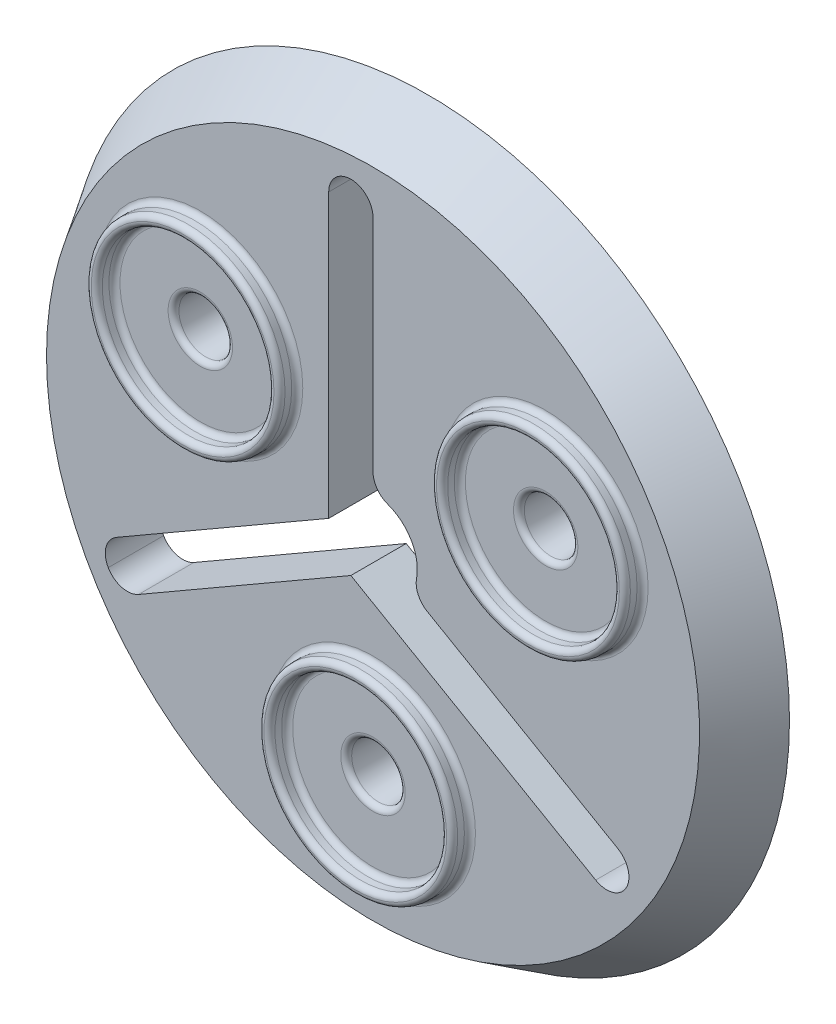
from build123d import *

# Parameters (mm, degrees)
SKETCH1_R                   = 32.6
BOSS_EXTRUDE1_DEPTH         = 5
CHAMFER1_SIZE               = 5
CHAMFER1_SIZE_2             = 3.12434676
CUT_EXTRUDE1_START          = 5
SKETCH2_R                   = 2.25
CUT_EXTRUDE1_DEPTH          = 52.373699443
CUT_EXTRUDE1_DRAFT          = 2
SKETCH3_R                   = 8.75
SKETCH3_R_2                 = 7.75
BOSS_EXTRUDE2_DEPTH         = 1.6
SKETCH5_R                   = 3.25
CUT_EXTRUDE3_DEPTH          = 0.8
FILLET1_R                   = 0.5
FILLET2_R                   = 0.5
CIRPATTERN3_COUNT           = 3
CIRPATTERN3_START           = 5
CIRPATTERN3_COPY_1_SKETCH_R = 2.25
CIRPATTERN3_COPY_1_DEPTH    = 52.373699443
CIRPATTERN3_COPY_1_DRAFT    = 2
CIRPATTERN3_COPY_2_SKETCH_R = 2.25
CIRPATTERN3_COPY_2_DEPTH    = 52.373699443
CIRPATTERN3_COPY_2_DRAFT    = 2
FILLET1_OF_CIRPATTERN3_R    = 0.5
FILLET2_OF_CIRPATTERN3_R    = 0.5
SKETCH4_R                   = 4
CUT_EXTRUDE2_DEPTH          = 47.573382971
FILLET3_R                   = 2


with BuildPart() as part:
    # Sketch1 → Boss-Extrude1 (new body)
    with BuildSketch(Plane(origin=(0, 0, 0), x_dir=(0, 1, 0), z_dir=(0, 0, 1))):
        with Locations(Location((0, 0, 0), (0, 0, 270))):
            Circle(SKETCH1_R)
    extrude(amount=BOSS_EXTRUDE1_DEPTH)

    # Chamfer1
    # the kernel refuses this chamfer: 5, 3.12434676 mm, written as the material it takes off along each edge
    with BuildSketch(Plane(origin=(0, 0, 5), x_dir=(1, 0, 0), z_dir=(0, -1, 0))) as chamfer1_piece_1:
        Polygon((32.6, -CHAMFER1_SIZE), (32.6 - CHAMFER1_SIZE_2, 0), (32.6, 0), align=None)
    revolve(axis=Axis((0, 0, 5), (0, 0, 1)), mode=Mode.SUBTRACT)


with BuildPart() as cut_extrude1_tool:
    # Sketch2 → Cut-Extrude1 (with draft: the straight prism first)
    with BuildSketch(Plane(origin=(0, 0, 5), x_dir=(1, 0, 0), z_dir=(0, 0, -1)).offset(CUT_EXTRUDE1_START)):
        with Locations((0, 18)):
            Circle(SKETCH2_R)
    extrude(amount=-CUT_EXTRUDE1_DEPTH)
    # Cut-Extrude1: the draft: its side faces are tilted about the plane it starts from
    cut_extrude1_sides = [cut_extrude1_tool.faces().sort_by_distance(p)[0] for p in [
        (-2.25, -18, 26.186849721),
    ]]
    draft(cut_extrude1_sides, Plane(origin=(0, 0, 5), x_dir=(1, 0, 0), z_dir=(0, 0, -1)).offset(CUT_EXTRUDE1_START), CUT_EXTRUDE1_DRAFT)


with BuildPart() as part_1:
    add(part.part)

    # Cut-Extrude1: cut by cut_extrude1_tool
    add(cut_extrude1_tool.part, mode=Mode.SUBTRACT)

    # Sketch3 → Boss-Extrude2 (add)
    with BuildSketch(Plane.XY.offset(5)):
        with Locations((0, -18)):
            Circle(SKETCH3_R)
        with Locations((0, -18)):
            Circle(SKETCH3_R_2, mode=Mode.SUBTRACT)
    boss_extrude2 = extrude(amount=BOSS_EXTRUDE2_DEPTH)

    # Sketch5 → Cut-Extrude3 (cut)
    with BuildSketch(Plane(origin=(0, 0, 0), x_dir=(1, 0, 0), z_dir=(0, 0, -1))):
        with Locations(Location((0, 18, 0), (0, 0, 180))):
            Circle(SKETCH5_R)
    cut_extrude3 = extrude(amount=-CUT_EXTRUDE3_DEPTH, mode=Mode.SUBTRACT)

    # Fillet1
    fillet1_edges = [part_1.edges().sort_by_distance(p)[0] for p in [
        (-8.75, -18, 6.6),
        (-7.75, -18, 6.6),
    ]]
    fillet(fillet1_edges, radius=FILLET1_R - 0.0001)  # a hair under: the kernel refuses the full size

    # Fillet2
    fillet2_edges = [part_1.edges().sort_by_distance(p)[0] for p in [
        (-2.424603847, -18, 5),
        (-7.75, -18, 5),
        (-8.75, -18, 5),
    ]]
    fillet(fillet2_edges, radius=FILLET2_R)

    # CirPattern3: Boss-Extrude2, Cut-Extrude3 ×3 about axis
    cirpattern3_axis = Axis((0, 0, 0), (0, 0, 1))
    add([boss_extrude2.rotate(cirpattern3_axis, i * 360 / CIRPATTERN3_COUNT) for i in range(1, CIRPATTERN3_COUNT)])
    add([cut_extrude3.rotate(cirpattern3_axis, i * 360 / CIRPATTERN3_COUNT) for i in range(1, CIRPATTERN3_COUNT)], mode=Mode.SUBTRACT)


with BuildPart() as cirpattern3_copy_1_tool:
    # CirPattern3 copy 1 sketch → CirPattern3 copy 1 (with draft: the straight prism first)
    with BuildSketch(Plane(origin=(0, 0, 5), x_dir=(-0.4999999999999998, 0.8660254037844387, 0), z_dir=(0, 0, -1)).offset(CIRPATTERN3_START)):
        with Locations((0, 18)):
            Circle(CIRPATTERN3_COPY_1_SKETCH_R)
    extrude(amount=-CIRPATTERN3_COPY_1_DEPTH)
    # CirPattern3 copy 1: the draft: its side faces are tilted about the plane it starts from
    cirpattern3_copy_1_sides = [cirpattern3_copy_1_tool.faces().sort_by_distance(p)[0] for p in [
        (16.713457268, 7.051442841, 26.186849721),
    ]]
    draft(cirpattern3_copy_1_sides, Plane(origin=(0, 0, 5), x_dir=(-0.4999999999999998, 0.8660254037844387, 0), z_dir=(0, 0, -1)).offset(CIRPATTERN3_START), CIRPATTERN3_COPY_1_DRAFT)


with BuildPart() as part_2:
    add(part_1.part)

    # CirPattern3 copy 1: cut by cirpattern3_copy_1_tool
    add(cirpattern3_copy_1_tool.part, mode=Mode.SUBTRACT)


with BuildPart() as cirpattern3_copy_2_tool:
    # CirPattern3 copy 2 sketch → CirPattern3 copy 2 (with draft: the straight prism first)
    with BuildSketch(Plane(origin=(0, 0, 5), x_dir=(-0.5000000000000004, -0.8660254037844384, 0), z_dir=(0, 0, -1)).offset(CIRPATTERN3_START)):
        with Locations((0, 18)):
            Circle(CIRPATTERN3_COPY_2_SKETCH_R)
    extrude(amount=-CIRPATTERN3_COPY_2_DEPTH)
    # CirPattern3 copy 2: the draft: its side faces are tilted about the plane it starts from
    cirpattern3_copy_2_sides = [cirpattern3_copy_2_tool.faces().sort_by_distance(p)[0] for p in [
        (-14.463457268, 10.948557159, 26.186849721),
    ]]
    draft(cirpattern3_copy_2_sides, Plane(origin=(0, 0, 5), x_dir=(-0.5000000000000004, -0.8660254037844384, 0), z_dir=(0, 0, -1)).offset(CIRPATTERN3_START), CIRPATTERN3_COPY_2_DRAFT)


with BuildPart() as part_3:
    add(part_2.part)

    # CirPattern3 copy 2: cut by cirpattern3_copy_2_tool
    add(cirpattern3_copy_2_tool.part, mode=Mode.SUBTRACT)

    # Fillet1 of CirPattern3
    fillet1_of_cirpattern3_edges = [part_3.edges().sort_by_distance(p)[0] for p in [
        (19.963457268, 1.422277717, 6.6),
        (19.463457268, 2.288303121, 6.6),
        (-11.213457268, 16.577722283, 6.6),
        (-11.713457268, 15.711696879, 6.6),
    ]]
    fillet(fillet1_of_cirpattern3_edges, radius=FILLET1_OF_CIRPATTERN3_R - 0.0001)  # a hair under: the kernel refuses the full size

    # Fillet2 of CirPattern3
    fillet2_of_cirpattern3_edges = [part_3.edges().sort_by_distance(p)[0] for p in [
        (16.800759192, 6.900231474, 5),
        (19.463457268, 2.288303121, 5),
        (19.963457268, 1.422277717, 5),
        (-14.376155344, 11.099768526, 5),
        (-11.713457268, 15.711696879, 5),
        (-11.213457268, 16.577722283, 5),
    ]]
    fillet(fillet2_of_cirpattern3_edges, radius=FILLET2_OF_CIRPATTERN3_R)

    # Sketch4 → Cut-Extrude2 (cut, through all)
    with BuildSketch(Plane(origin=(0, 0, 0), x_dir=(1, 0, 0), z_dir=(0, 0, -1))):
        with BuildLine():
            Line((21.649947146, 17.118404966), (-2, 3.464101615))
            ThreePointArc((-2, 3.464101615), (1.03527618, 3.863703305), (3.464101615, 2))
            Line((3.464101615, 2), (23.902301144, 13.8))
            ThreePointArc((23.902301144, 13.8), (22.836479237, 15.500168259), (21.649947146, 17.118404966))
        make_face()
        Circle(SKETCH4_R)
        with BuildLine():
            ThreePointArc((0, -4), (-2.828427125, -2.828427125), (-4, 0))
            Line((-4, 0), (-4, -27.308606702))
            ThreePointArc((-4, -27.308606702), (-2.005299856, -27.527055282), (0, -27.6))
            Line((0, -27.6), (0, -4))
        make_face()
        with BuildLine():
            ThreePointArc((-22.839463081, 15.495771235), (-23.902301144, 13.8), (-24.839463081, 12.03166962))
            Line((-24.839463081, 12.03166962), (-4, 0))
            ThreePointArc((-4, 0), (-3.464101615, 2), (-2, 3.464101615))
            Line((-2, 3.464101615), (-22.839463081, 15.495771235))
        make_face()
    extrude(amount=-CUT_EXTRUDE2_DEPTH, mode=Mode.SUBTRACT)

    # Fillet3
    fillet3_edges = [part_3.edges().sort_by_distance(p)[0] for p in [
        (-24.839463081, -12.03166962, 2.5),
        (-22.839463081, -15.495771235, 2.5),
        (0, 27.6, 2.5),
        (-4, 27.308606702, 2.5),
        (3.464101615, -2, 2.5),
        (0, 4, 2.5),
        (21.649947146, -17.118404966, 2.5),
        (23.902301144, -13.8, 2.5),
    ]]
    fillet(fillet3_edges, radius=FILLET3_R - 0.0001)  # a hair under: the kernel refuses the full size

    # Chamfer2: read off the stored shape, not the designer's step
    # Chamfer2 outline → Chamfer2 (revolve)
    with BuildSketch(Plane(origin=(15.588457268, 9, 0), x_dir=(1, 0, 0), z_dir=(0, -1, 0))):
        Polygon((2.276993966, 0.773006034), (3.05, 0), (3.25, 0), (3.25, 0.8), (2.276993966, 0.8), align=None)
    revolve(axis=Axis((15.588457268, 9, 0), (0, 0, 1)))

    # Chamfer2 2 outline → Chamfer2 2 (revolve)
    with BuildSketch(Plane.XZ.offset(18)):
        Polygon((2.276993966, 0.773006034), (3.05, 0), (3.25, 0), (3.25, 0.8), (2.276993966, 0.8), align=None)
    revolve(axis=Axis((0, -18, 0), (0, 0, 1)))

    # Chamfer2 3 outline → Chamfer2 3 (revolve)
    with BuildSketch(Plane(origin=(-15.588457268, 9, 0), x_dir=(1, 0, 0), z_dir=(0, -1, 0))):
        Polygon((2.276993966, 0.773006034), (3.05, 0), (3.25, 0), (3.25, 0.8), (2.276993966, 0.8), align=None)
    revolve(axis=Axis((-15.588457268, 9, 0), (0, 0, 1)))


solid = part_3.part
